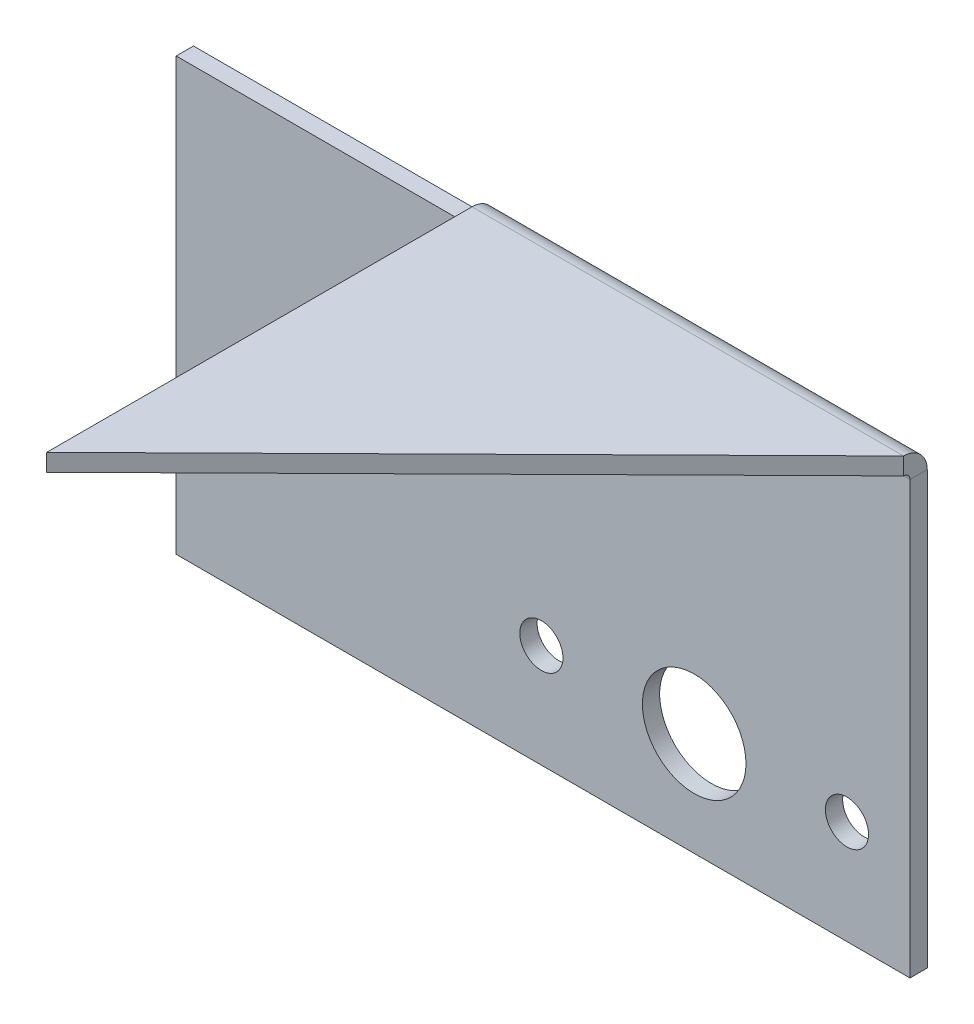
from build123d import *

# Parameters (mm, degrees)
CROQUIS1_W             = 85
CROQUIS1_H             = 50
BRIDA_BASE1_DEPTH      = 2
BRIDA_DE_ARISTA1_DEPTH = 85
DESDOBLAR1_START       = -42.5
DESDOBLAR1_DEPTH       = 85
DESDOBLAR1_2_DEPTH     = 85
CROQUIS11_W            = 35
CROQUIS11_H            = 49.2634
CROQUIS11_H_2          = 2.727844901
CORTAR_EXTRUIR1_DEPTH  = 10
DOBLAR1_START          = 27.727844901
DOBLAR1_OUTLINE_W      = 50
DOBLAR1_OUTLINE_H      = 2
DOBLAR1_DEPTH          = 50.272155099
DOBLAR1_START_2        = 25.7366
DOBLAR1_2_DEPTH        = 1.725934706
DOBLAR1_START_3        = 25
DOBLAR1_3_DEPTH        = 2.7366
DOBLAR1_START_4        = -7.5
DOBLAR1_4_DEPTH        = 50.5
CROQUIS12_R            = 6
CROQUIS12_R_2          = 2.5
CORTAR_EXTRUIR2_DEPTH  = 10


with BuildPart() as part:
    # Brida base1: sheet metal written as solids
    # Croquis1 → Brida base1 (new body)
    with BuildSketch(Plane.XY):
        Rectangle(CROQUIS1_W, CROQUIS1_H)
    extrude(amount=-BRIDA_BASE1_DEPTH)

    # Brida de arista1: sheet metal written as solids
    # Brida de arista1 section (on a plane across the edge) → Brida de arista1 (add)
    with BuildSketch(Plane(origin=(42.5, 25.7366, 0), x_dir=(0, -1, 0), z_dir=(-1, 0, 0))):
        with BuildLine():
            Line((-2, 0.7366), (-2, 50))
            Line((-2, 50), (0, 50))
            Line((0, 50), (0, 0.7366))
            ThreePointArc((0, 0.7366), (0.215745145, 0.215745145), (0.7366, 0))
            Line((0.7366, 0), (0.7366, -2))
            ThreePointArc((0.7366, -2), (-1.198468417, -1.198468417), (-2, 0.7366))
        make_face()
    extrude(amount=BRIDA_DE_ARISTA1_DEPTH)

    # Desdoblar1: read off the stored shape, not the designer's step
    # Desdoblar1 outline → Desdoblar1 (cut)
    with BuildSketch(Plane.YZ.offset(DESDOBLAR1_START)):
        with BuildLine():
            Line((25, 0), (27.635602398, 0))
            ThreePointArc((27.635602398, 0), (27.711233029, 0.364854094), (27.7366, 0.7366))
            Line((27.7366, 0.7366), (27.7366, 50))
            Line((27.7366, 50), (25.7366, 50))
            Line((25.7366, 50), (25.7366, 0.7366))
            ThreePointArc((25.7366, 0.7366), (25.520854855, 0.215745145), (25, 0))
        make_face()
    extrude(amount=DESDOBLAR1_DEPTH, mode=Mode.SUBTRACT)

    # Desdoblar1 2 outline → Desdoblar1 2 (add)
    with BuildSketch(Plane.YZ.offset(DESDOBLAR1_START)):
        with BuildLine():
            Line((25, -2), (76.991244901, -2))
            Line((76.991244901, -2), (76.991244901, 0))
            Line((76.991244901, 0), (27.635602398, 0))
            ThreePointArc((27.635602398, 0), (26.654267209, -1.443395312), (25, -2))
        make_face()
    extrude(amount=DESDOBLAR1_2_DEPTH)

    # Croquis11 → Cortar-Extruir1 (cut)
    with BuildSketch(Plane.XY):
        with Locations((-25, 52.359544901)):
            Rectangle(CROQUIS11_W, CROQUIS11_H)
        with Locations((-25, 26.36392245)):
            Rectangle(CROQUIS11_W, CROQUIS11_H_2)
        Polygon((42.5, 76.991244901), (-7.5, 76.991244901), (42.5, 27.727844901), align=None)
    extrude(amount=-CORTAR_EXTRUIR1_DEPTH, mode=Mode.SUBTRACT)

    # Doblar1: read off the stored shape, not the designer's step
    # Doblar1 outline → Doblar1 (cut)
    with BuildSketch(Plane(origin=(0, 0, 0), x_dir=(1, 0, 0), z_dir=(0, 1, 0)).offset(DOBLAR1_START)):
        with Locations((17.5, 1)):
            Rectangle(DOBLAR1_OUTLINE_W, DOBLAR1_OUTLINE_H)
    extrude(amount=DOBLAR1_DEPTH, mode=Mode.SUBTRACT)

    # Doblar1 2 outline → Doblar1 2 (add)
    with BuildSketch(Plane(origin=(0, 0, 0), x_dir=(1, 0, 0), z_dir=(0, 1, 0)).offset(DOBLAR1_START_2)):
        Polygon((-7.5, -50), (42.5, -0.7366), (42.5, 0), (-7.5, 0), align=None)
    extrude(amount=DOBLAR1_2_DEPTH)

    # Doblar1 3 outline → Doblar1 3 (add)
    with BuildSketch(Plane(origin=(0, 0, 0), x_dir=(1, 0, 0), z_dir=(0, 1, 0)).offset(DOBLAR1_START_3)):
        Polygon((-7.5, 0), (-7.5, -50), (42.5, -0.7366), (42.5, 0), align=None)
    extrude(amount=DOBLAR1_3_DEPTH)

    # Doblar1 4 outline → Doblar1 4 (cut)
    with BuildSketch(Plane.YZ.offset(DOBLAR1_START_4)):
        with BuildLine():
            ThreePointArc((27.7366, 0.7366), (26.935068417, -1.198468417), (25, -2))
            Line((25, -2), (24, -2))
            Line((24, -2), (24, -4))
            Line((24, -4), (27.727844901, -4))
            Line((27.727844901, -4), (27.727844901, 0))
            Line((27.727844901, 0), (29, 0))
            Line((29, 0), (29, 52))
            Line((29, 52), (27.736600025, 52))
            Line((27.736600025, 52), (27.7366, 0.7366))
        make_face()
        with BuildLine():
            Line((25.7366, 0.7366), (25.7366, 52))
            Line((25.7366, 52), (25, 52))
            Line((25, 52), (25, 0))
            ThreePointArc((25, 0), (25.520854855, 0.215745145), (25.7366, 0.7366))
        make_face()
    extrude(amount=DOBLAR1_4_DEPTH, mode=Mode.SUBTRACT)

    # Croquis12 → Cortar-Extruir2 (cut)
    with BuildSketch(Plane.XY):
        with Locations((17.5, -13)):
            Circle(CROQUIS12_R)
        with Locations((35.2, -13)):
            Circle(CROQUIS12_R_2)
        with Locations((-0.2, -13)):
            Circle(CROQUIS12_R_2)
    extrude(amount=-CORTAR_EXTRUIR2_DEPTH, mode=Mode.SUBTRACT)


solid = part.part
